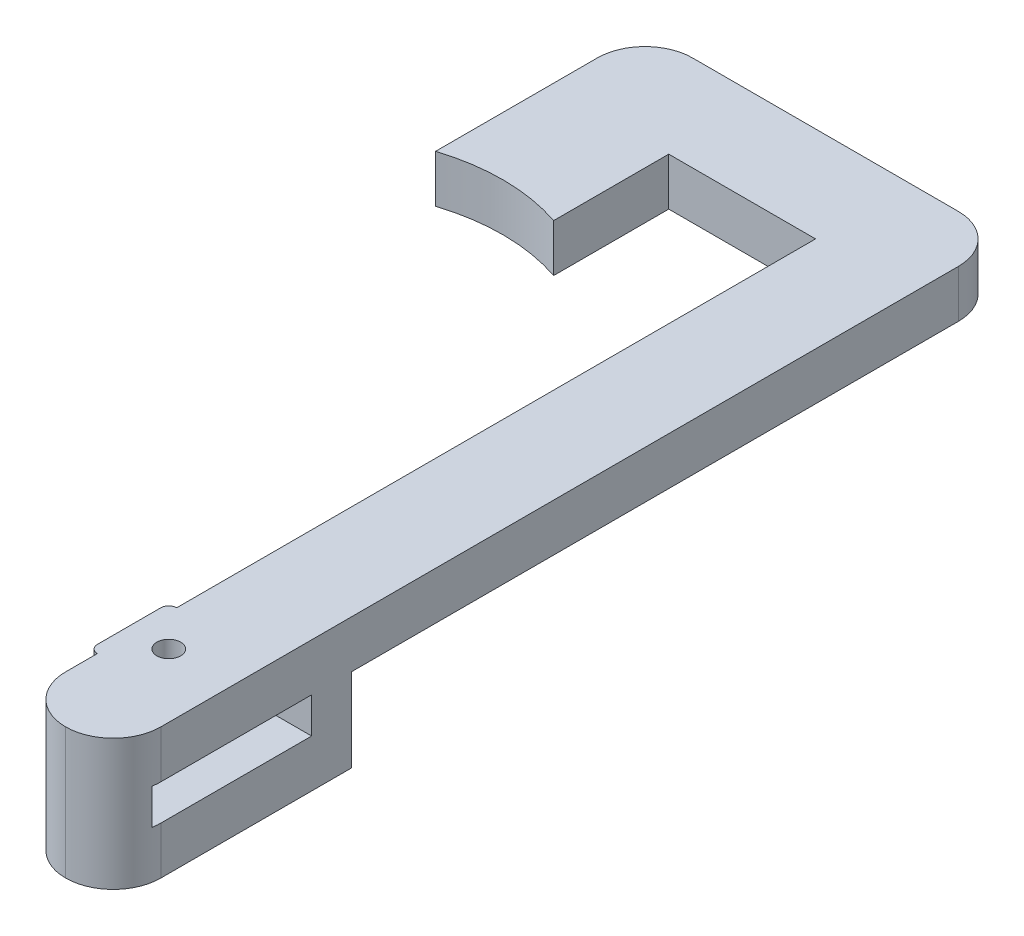
from build123d import *

# Parameters (mm, degrees)
BOSS_EXTRUDE1_DEPTH = 3
SKETCH2_R           = 12
CUT_EXTRUDE1_DEPTH  = 3
SKETCH5_W           = 6
SKETCH5_H           = 2.5
BOSS_EXTRUDE2_DEPTH = 5.25
SKETCH6_W           = 6
SKETCH6_H           = 3
BOSS_EXTRUDE3_DEPTH = 10
CUT_EXTRUDE2_REACH  = 54.879
SKETCH4_R           = 0.75
FILLET1_R           = 3
SKETCH8_W           = 0.5
SKETCH8_H           = 5
BOSS_EXTRUDE4_DEPTH = 3
FILLET2_R           = 0.5


# Some blends are built 0.0001 mm under size
with BuildPart() as part:
    # Sketch1 → Boss-Extrude1 (new body)
    with BuildSketch(Plane(origin=(0, 0, 0), x_dir=(1, 0, 0), z_dir=(0, 1, 0))):
        Polygon((-2, -7.5), (4, -7.5), (4, 48.75), (-18.75, 48.75), (-18.75, 28.369317262), (-11.25, 28.369317262), (-11.25, 42.75), (-2, 42.75), (-2, 2.5), (-2.5, 2.5), (-2.5, -2.5), (-2, -2.5), align=None)
    extrude(amount=BOSS_EXTRUDE1_DEPTH)

    # Sketch2 → Cut-Extrude1 (cut)
    with BuildSketch(Plane(origin=(0, 3, 0), x_dir=(1, 0, 0), z_dir=(0, 1, 0))):
        with Locations((-15.091915752, 24.129582051)):
            Circle(SKETCH2_R)
    extrude(amount=-CUT_EXTRUDE1_DEPTH, mode=Mode.SUBTRACT)

    # Sketch5 → Boss-Extrude2 (add)
    with BuildSketch(Plane.XZ):
        with Locations((1, -6.25)):
            Rectangle(SKETCH5_W, SKETCH5_H)
        with Locations((1, 6.25)):
            Rectangle(SKETCH5_W, SKETCH5_H)
    extrude(amount=BOSS_EXTRUDE2_DEPTH)

    # Sketch6 → Boss-Extrude3 (add)
    with BuildSketch(Plane(origin=(0, 0, 5), x_dir=(-1, 0, 0), z_dir=(0, 0, -1))):
        with Locations((-1, -3.75)):
            Rectangle(SKETCH6_W, SKETCH6_H)
    extrude(amount=BOSS_EXTRUDE3_DEPTH)

    # Cut-Extrude2: up to this face of the body (flat: up to its plane)
    cut_extrude2_end = Plane(part.part.faces().sort_by_distance((1, -5.25, 0))[0])
    # Sketch4 → Cut-Extrude2 (cut, up to the picked face)
    with BuildSketch(Plane(origin=(0, 3, 0), x_dir=(1, 0, 0), z_dir=(0, 1, 0)), mode=Mode.PRIVATE) as cut_extrude2_sk1:
        with Locations(Location((0, 0, 0), (0, 0, 90))):
            Circle(SKETCH4_R)
    cut_extrude2_tool1 = split(extrude(cut_extrude2_sk1.sketch, amount=-CUT_EXTRUDE2_REACH, mode=Mode.PRIVATE), bisect_by=cut_extrude2_end, keep=Keep.BOTH, mode=Mode.PRIVATE)
    add(cut_extrude2_tool1.solids().sort_by(Axis((0, 3, 0), (0, -1, 0)))[0], mode=Mode.SUBTRACT)

    # Fillet1
    # the kernel refuses this fillet: 3 mm, written as the material it takes off along each edge
    with BuildSketch(Plane(origin=(-18.75, -7.5, -48.75), x_dir=(1, 0, 0), z_dir=(0, 1, 0)), Plane(origin=(4, -7.5, -48.75), x_dir=(0, 0, 1), z_dir=(0, 1, 0))) as fillet1_piece_1:
        with BuildLine():
            CenterArc((FILLET1_R, -FILLET1_R), FILLET1_R, 90, 90)
            Line((0, -FILLET1_R), (0, 0))
            Line((0, 0), (FILLET1_R, 0))
        make_face()
    extrude(amount=18, mode=Mode.SUBTRACT)
    with BuildSketch(Plane(origin=(4, -12.75, 7.5), x_dir=(-1, 0, 0), z_dir=(0, 1, 0)), Plane(origin=(-2, -12.75, 7.5), x_dir=(0, 0, -1), z_dir=(0, 1, 0))) as fillet1_piece_2:
        with BuildLine():
            CenterArc((FILLET1_R, -FILLET1_R), FILLET1_R, 90, 90)
            Line((0, -FILLET1_R), (0, 0))
            Line((0, 0), (FILLET1_R, 0))
        make_face()
    extrude(amount=23.25, mode=Mode.SUBTRACT)

    # Sketch8 → Boss-Extrude4 (add)
    with BuildSketch(Plane(origin=(0, -2.25, 0), x_dir=(1, 0, 0), z_dir=(0, 1, 0))):
        with Locations((-2.25, 0)):
            Rectangle(SKETCH8_W, SKETCH8_H)
    extrude(amount=-BOSS_EXTRUDE4_DEPTH)

    # Fillet2
    fillet2_edges = [part.edges().sort_by_distance(p)[0] for p in [
        (-2.5, 1.5, 2.5),
        (-2.5, 1.5, -2.5),
        (-2.5, -3.75, 2.5),
        (-2.5, -3.75, -2.5),
    ]]
    fillet(fillet2_edges, radius=FILLET2_R - 0.0001)  # a hair under: the kernel refuses the full size


solid = part.part
